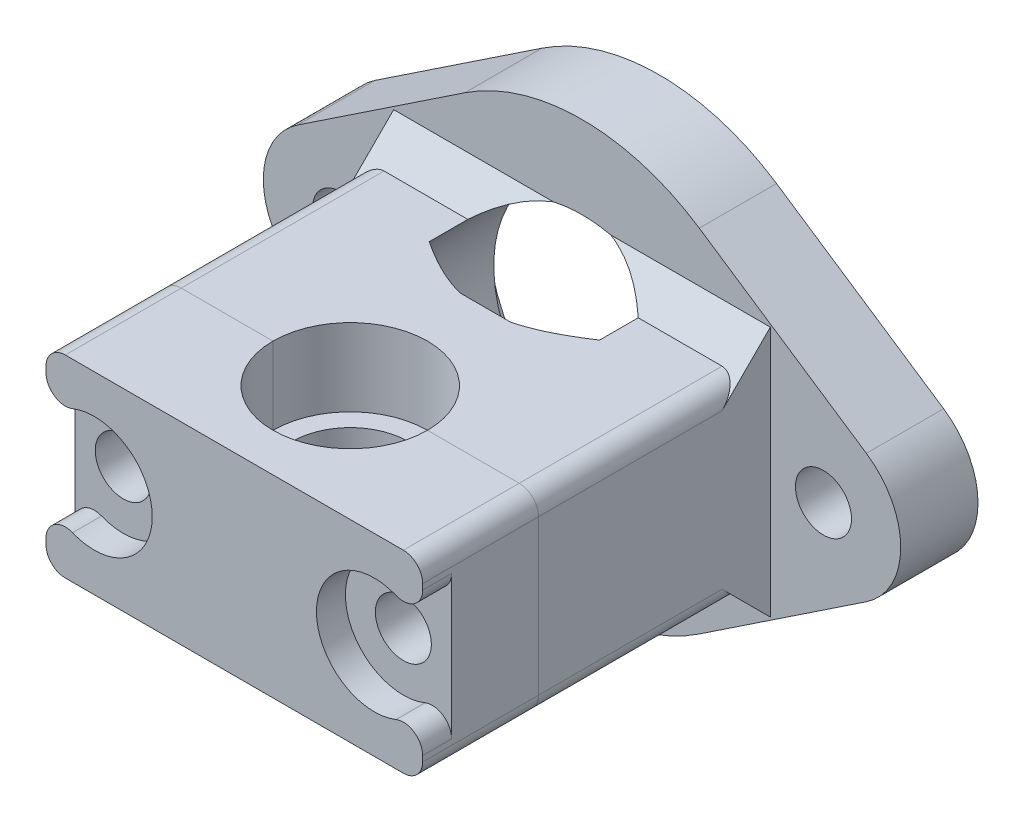
from build123d import *

# Parameters (mm, degrees)
BOSS_EXTRUDE1_DEPTH                            = 4
CUT_EXTRUDE1_DEPTH                             = 21.196012137
CUT_EXTRUDE1_DEPTH_BACK                        = 21.196012137
CUT_EXTRUDE2_DEPTH                             = 1.9
CUT_EXTRUDE2_DEPTH_BACK                        = 21.196012137
SKETCH1_6_R                                    = 8.9375
M2_5_CLEARANCE_HOLE1_D                         = 2.9
SKETCH4_W                                      = 19.5
SKETCH4_H                                      = 10
BOSS_EXTRUDE2_DEPTH                            = 12
SKETCH6_R                                      = 6.6675
CUT_EXTRUDE3_DEPTH                             = 5
SKETCH8_W                                      = 19.5
SKETCH8_H                                      = 10
BOSS_EXTRUDE3_DEPTH                            = 6
CUT_EXTRUDE4_DEPTH                             = 30.595251414
CUT_EXTRUDE4_DEPTH_BACK                        = 30.595251414
SKETCH9_R                                      = 4
BOSS_EXTRUDE4_DEPTH                            = 1
BOSS_EXTRUDE5_DEPTH                            = 1
CHAMFER2_SIZE                                  = 1.5
TAP_DRILL_FOR_M2_5X0_45_TAP1_AT_2_COUNT        = 2
TAP_DRILL_FOR_M2_5X0_45_TAP1_AT_2_PITCH        = 14.5
CBORE_FOR_M2_5_PAN_HEAD_MACHINE_SCREW1_A_COUNT = 2
CBORE_FOR_M2_5_PAN_HEAD_MACHINE_SCREW1_A_PITCH = 14.5
FILLET1_R                                      = 1
FILLET2_R                                      = 1


with BuildPart() as part:
    # Sketch1 → Boss-Extrude1 (new body)
    with BuildSketch(Plane.XY):
        with BuildLine():
            ThreePointArc((14.72, -3.327401388), (16.5, 0), (14.72, 3.327401388))
            Line((14.72, 3.327401388), (6.0703125, 9.098363172))
            ThreePointArc((6.0703125, 9.098363172), (0, 10.9375), (-6.0703125, 9.098363172))
            Line((-6.0703125, 9.098363172), (-14.72, 3.327401388))
            ThreePointArc((-14.72, 3.327401388), (-16.5, 0), (-14.72, -3.327401388))
            Line((-14.72, -3.327401388), (-6.0703125, -9.098363172))
            ThreePointArc((-6.0703125, -9.098363172), (0, -10.9375), (6.0703125, -9.098363172))
            Line((6.0703125, -9.098363172), (14.72, -3.327401388))
        make_face()
    extrude(amount=BOSS_EXTRUDE1_DEPTH)

    # Sketch1<4> → Cut-Extrude1 (cut, two sides: drawn at the far end of the back side and taken through both)
    with BuildSketch(Plane.XY.offset(-CUT_EXTRUDE1_DEPTH_BACK)):
        with BuildLine():
            ThreePointArc((-6.6675, 0), (0, -6.6675), (6.6675, 0))
            Line((6.6675, 0), (-6.6675, 0))
        make_face()
        with BuildLine():
            Line((-6.6675, 0), (6.6675, 0))
            ThreePointArc((6.6675, 0), (0, 6.6675), (-6.6675, 0))
        make_face()
    extrude(amount=CUT_EXTRUDE1_DEPTH + CUT_EXTRUDE1_DEPTH_BACK, mode=Mode.SUBTRACT)

    # Sketch1<6> → Cut-Extrude2 (cut, two sides: drawn at the far end of the back side and taken through both)
    with BuildSketch(Plane.XY.offset(-CUT_EXTRUDE2_DEPTH_BACK)):
        Circle(SKETCH1_6_R)
    extrude(amount=CUT_EXTRUDE2_DEPTH + CUT_EXTRUDE2_DEPTH_BACK, mode=Mode.SUBTRACT)

    # M2.5 Clearance Hole1 (through all)
    with Locations(Plane.XY.offset(4)):
        with Locations((-12.5, 0), (12.5, 0)):
            Hole(M2_5_CLEARANCE_HOLE1_D / 2)

    # Sketch4 → Boss-Extrude2 (add)
    with BuildSketch(Plane.XY.offset(4)):
        Rectangle(SKETCH4_W, SKETCH4_H)
    extrude(amount=BOSS_EXTRUDE2_DEPTH)

    # Sketch6 → Cut-Extrude3 (cut)
    with BuildSketch(Plane(origin=(0, 0, 4), x_dir=(-1, 0, 0), z_dir=(0, 0, -1))):
        with Locations(Location((0, 0, 0), (0, 0, 180))):
            Circle(SKETCH6_R)
    extrude(amount=-CUT_EXTRUDE3_DEPTH, mode=Mode.SUBTRACT)


with BuildPart() as body_2:
    # Sketch8 → Boss-Extrude3 (new body)
    with BuildSketch(Plane.XY.offset(16)):
        Rectangle(SKETCH8_W, SKETCH8_H)
    extrude(amount=BOSS_EXTRUDE3_DEPTH)


with BuildPart() as cut_extrude4_tool:
    # Sketch9 → Cut-Extrude4 (new, two sides: drawn at the far end of the back side and taken through both)
    with BuildSketch(Plane(origin=(0, 0, 0), x_dir=(1, 0, 0), z_dir=(0, 1, 0)).offset(-CUT_EXTRUDE4_DEPTH_BACK)):
        with Locations((0, -16)):
            Circle(SKETCH9_R)
    extrude(amount=CUT_EXTRUDE4_DEPTH + CUT_EXTRUDE4_DEPTH_BACK)


with BuildPart() as part_1:
    add(part.part)

    # Cut-Extrude4: cut by cut_extrude4_tool
    add(cut_extrude4_tool.part, mode=Mode.SUBTRACT)

    # Sketch9<3> → Boss-Extrude4 (add, symmetric)
    with BuildSketch(Plane(origin=(0, 0, 0), x_dir=(1, 0, 0), z_dir=(0, 1, 0))):
        with BuildLine():
            ThreePointArc((-3, -16), (0, -13), (3, -16))
            Line((3, -16), (4, -16))
            ThreePointArc((4, -16), (0, -12), (-4, -16))
            Line((-4, -16), (-3, -16))
        make_face()
    extrude(amount=BOSS_EXTRUDE4_DEPTH, both=True)

    # Chamfer2
    # the kernel refuses this chamfer: 1.5 mm, written as the material it adds along each edge
    with BuildSketch(Plane(origin=(9.75, -5, 4), x_dir=(0, -0.9996219169112969, -0.027495876610586497), z_dir=(-1, 0, 0))) as chamfer2_piece_1_section:
        Polygon((CHAMFER2_SIZE * 0.999621916911, CHAMFER2_SIZE * 0.0274958766106), (-CHAMFER2_SIZE * 0.0274958766106, CHAMFER2_SIZE * 0.999621916911), (0, 0), align=None)
    chamfer2_piece_1 = extrude(amount=9.196679183, mode=Mode.PRIVATE)
    chamfer2_piece_1 = chamfer2_piece_1 - Plane(origin=(0, 0, 4.474133211), x_dir=(-1, 0, 0), z_dir=(0, 0, -1)) * Cylinder(6.6675, 25, mode=Mode.PRIVATE)
    add(chamfer2_piece_1)
    with BuildSketch(Plane(origin=(0.553320817, 5, 4), x_dir=(0, 0.9996219169112969, -0.027495876610586497), z_dir=(1, 0, 0))) as chamfer2_piece_2_section:
        Polygon((CHAMFER2_SIZE * 0.999621916911, CHAMFER2_SIZE * 0.0274958766106), (-CHAMFER2_SIZE * 0.0274958766106, CHAMFER2_SIZE * 0.999621916911), (0, 0), align=None)
    chamfer2_piece_2 = extrude(amount=9.196679183, mode=Mode.PRIVATE)
    chamfer2_piece_2 = chamfer2_piece_2 - Plane(origin=(0, 0, 4.474133218), x_dir=(-1, 0, 0), z_dir=(0, 0, -1)) * Cylinder(6.6675, 25, mode=Mode.PRIVATE)
    add(chamfer2_piece_2)
    with BuildSketch(Plane(origin=(-9.75, 5, 4), x_dir=(0, 0.9996219169112969, -0.027495876610586497), z_dir=(1, 0, 0))) as chamfer2_piece_3_section:
        Polygon((CHAMFER2_SIZE * 0.999621916911, CHAMFER2_SIZE * 0.0274958766106), (-CHAMFER2_SIZE * 0.0274958766106, CHAMFER2_SIZE * 0.999621916911), (0, 0), align=None)
    chamfer2_piece_3 = extrude(amount=9.196679183, mode=Mode.PRIVATE)
    chamfer2_piece_3 = chamfer2_piece_3 - Plane(origin=(0, 0, 4.474133211), x_dir=(-1, 0, 0), z_dir=(0, 0, -1)) * Cylinder(6.6675, 25, mode=Mode.PRIVATE)
    add(chamfer2_piece_3)
    with BuildSketch(Plane(origin=(-0.553320817, -5, 4), x_dir=(0, -0.9996219169112969, -0.027495876610586497), z_dir=(-1, 0, 0))) as chamfer2_piece_4_section:
        Polygon((CHAMFER2_SIZE * 0.999621916911, CHAMFER2_SIZE * 0.0274958766106), (-CHAMFER2_SIZE * 0.0274958766106, CHAMFER2_SIZE * 0.999621916911), (0, 0), align=None)
    chamfer2_piece_4 = extrude(amount=9.196679183, mode=Mode.PRIVATE)
    chamfer2_piece_4 = chamfer2_piece_4 - Plane(origin=(0, 0, 4.474133218), x_dir=(-1, 0, 0), z_dir=(0, 0, -1)) * Cylinder(6.6675, 25, mode=Mode.PRIVATE)
    add(chamfer2_piece_4)
    with BuildSketch(Plane(origin=(0, 0, 9), x_dir=(1, 0, 0), z_dir=(0, 1, 0))) as chamfer2_piece_5_section:
        Polygon((6.6675 - CHAMFER2_SIZE, 0), (6.6675, CHAMFER2_SIZE), (6.6675, 0), align=None)
    chamfer2_piece_5 = revolve(axis=Axis((0, 0, 9), (0, 0, -1)), revolution_arc=81.734975252, mode=Mode.PRIVATE)
    chamfer2_piece_5 = split(chamfer2_piece_5, bisect_by=Plane(origin=(5.259793087, -5, 8.512416934), z_dir=(0, 1, 0)), keep=Keep.TOP, mode=Mode.PRIVATE)
    add(chamfer2_piece_5)
    with BuildSketch(Plane(origin=(0, 0, 9), x_dir=(-0.1435510514142993, -0.9896429131953854, 0), z_dir=(0.9896429131953854, -0.1435510514142993, 0))) as chamfer2_piece_6_section:
        Polygon((6.6675 - CHAMFER2_SIZE, 0), (6.6675, CHAMFER2_SIZE), (6.6675, 0), align=None)
    chamfer2_piece_6 = revolve(axis=Axis((0, 0, 9), (0, 0, -1)), revolution_arc=163.493234438, mode=Mode.PRIVATE)
    chamfer2_piece_6 = split(chamfer2_piece_6, bisect_by=Plane(origin=(-5.93475428, 5, 8.26725428), z_dir=(0, -1, 0)), keep=Keep.TOP, mode=Mode.PRIVATE)
    chamfer2_piece_6 = split(chamfer2_piece_6, bisect_by=Plane(origin=(-5.93475428, -5, 8.26725428), z_dir=(0, 1, 0)), keep=Keep.TOP, mode=Mode.PRIVATE)
    add(chamfer2_piece_6)
    with BuildSketch(Plane(origin=(0, 0, 9), x_dir=(0.14375213464834083, 0.9896137245329842, 0), z_dir=(-0.9896137245329842, 0.14375213464834083, 0))) as chamfer2_piece_7_section:
        Polygon((6.6675, CHAMFER2_SIZE), (6.6675 - CHAMFER2_SIZE, 0), (6.6675, 0), align=None)
    chamfer2_piece_7 = revolve(axis=Axis((0, 0, 9), (0, 0, -1)), revolution_arc=81.734975252, mode=Mode.PRIVATE)
    chamfer2_piece_7 = split(chamfer2_piece_7, bisect_by=Plane(origin=(5.259793397, 5, 8.512416854), z_dir=(0, -1, 0)), keep=Keep.TOP, mode=Mode.PRIVATE)
    add(chamfer2_piece_7)

    # Sketch12 → Tap Drill for M2.5x0.45 Tap1 (revolve, cut)
    with BuildSketch(Plane(origin=(-7.25, 0, 22), x_dir=(0, -1, 0), z_dir=(1, 0, 0))):
        Polygon((0, 0), (0, 13.615882135), (1.025, 13), (1.025, 0), align=None)
    tap_drill_for_m2_5x0_45_tap1 = revolve(axis=Axis((-7.25, 0, 28.35), (0, 0, -1)), mode=Mode.SUBTRACT)

    # Tap Drill for M2.5x0.45 Tap1 at 2: Tap Drill for M2.5x0.45 Tap1 ×2
    with Locations(*[(i * TAP_DRILL_FOR_M2_5X0_45_TAP1_AT_2_PITCH, 0, 0) for i in range(1, TAP_DRILL_FOR_M2_5X0_45_TAP1_AT_2_COUNT)]):
        add(tap_drill_for_m2_5x0_45_tap1, mode=Mode.SUBTRACT)

    # Fillet1
    # the kernel refuses this fillet: 1 mm, written as the material it takes off along each edge
    with BuildSketch(Plane(origin=(-9.75, 5, 3), x_dir=(1, 0, 0), z_dir=(0, 0, 1))) as fillet1_piece_1_section:
        with BuildLine():
            CenterArc((FILLET1_R, -FILLET1_R), FILLET1_R, 90, 90)
            Line((0, -FILLET1_R), (0, 0))
            Line((0, 0), (FILLET1_R, 0))
        make_face()
    fillet1_piece_1 = extrude(amount=15.5, mode=Mode.PRIVATE)
    fillet1_piece_1 = split(fillet1_piece_1, bisect_by=Plane(origin=(-9.521455398, 1.582932532, 8.917067468), z_dir=(0, 0.7071067811868302, 0.7071067811862648)), keep=Keep.TOP, mode=Mode.PRIVATE)
    add(fillet1_piece_1, mode=Mode.SUBTRACT)
    with BuildSketch(Plane(origin=(-9.75, -5, 3), x_dir=(1, 0, 0), z_dir=(0, 0, 1))) as fillet1_piece_2_section:
        with BuildLine():
            CenterArc((FILLET1_R, FILLET1_R), FILLET1_R, 180, 90)
            Line((0, FILLET1_R), (0, 0))
            Line((0, 0), (FILLET1_R, 0))
        make_face()
    fillet1_piece_2 = extrude(amount=15.5, mode=Mode.PRIVATE)
    fillet1_piece_2 = split(fillet1_piece_2, bisect_by=Plane(origin=(-9.521455398, -1.582932532, 8.917067468), z_dir=(0, -0.7071067811868302, 0.7071067811862648)), keep=Keep.TOP, mode=Mode.PRIVATE)
    add(fillet1_piece_2, mode=Mode.SUBTRACT)
    with BuildSketch(Plane(origin=(9.75, -5, 3), x_dir=(-1, 0, 0), z_dir=(0, 0, 1))) as fillet1_piece_3_section:
        with BuildLine():
            CenterArc((FILLET1_R, -FILLET1_R), FILLET1_R, 90, 90)
            Line((0, -FILLET1_R), (0, 0))
            Line((0, 0), (FILLET1_R, 0))
        make_face()
    fillet1_piece_3 = extrude(amount=15.5, mode=Mode.PRIVATE)
    fillet1_piece_3 = split(fillet1_piece_3, bisect_by=Plane(origin=(9.521455398, -1.582932532, 8.917067468), z_dir=(0, -0.7071067811868302, 0.7071067811862648)), keep=Keep.TOP, mode=Mode.PRIVATE)
    add(fillet1_piece_3, mode=Mode.SUBTRACT)
    with BuildSketch(Plane(origin=(9.75, 5, 3), x_dir=(-1, 0, 0), z_dir=(0, 0, 1))) as fillet1_piece_4_section:
        with BuildLine():
            CenterArc((FILLET1_R, FILLET1_R), FILLET1_R, 180, 90)
            Line((0, FILLET1_R), (0, 0))
            Line((0, 0), (FILLET1_R, 0))
        make_face()
    fillet1_piece_4 = extrude(amount=15.5, mode=Mode.PRIVATE)
    fillet1_piece_4 = split(fillet1_piece_4, bisect_by=Plane(origin=(9.521455398, 1.582932532, 8.917067468), z_dir=(0, 0.7071067811868302, 0.7071067811862648)), keep=Keep.TOP, mode=Mode.PRIVATE)
    add(fillet1_piece_4, mode=Mode.SUBTRACT)


with BuildPart() as body_2_1:
    add(body_2.part)

    # Cut-Extrude4: cut by cut_extrude4_tool
    add(cut_extrude4_tool.part, mode=Mode.SUBTRACT)

    # Sketch9<4> → Boss-Extrude5 (add, symmetric)
    with BuildSketch(Plane(origin=(0, 0, 0), x_dir=(1, 0, 0), z_dir=(0, 1, 0))):
        with BuildLine():
            Line((4, -16), (3, -16))
            ThreePointArc((3, -16), (0, -19), (-3, -16))
            Line((-3, -16), (-4, -16))
            ThreePointArc((-4, -16), (0, -20), (4, -16))
        make_face()
    extrude(amount=BOSS_EXTRUDE5_DEPTH, both=True)

    # Sketch14 → CBORE for M2.5 Pan Head Machine Screw1 (revolve, cut)
    with BuildSketch(Plane(origin=(7.25, 0, 22), x_dir=(0, -1, 0), z_dir=(1, 0, 0))):
        Polygon((0, 0), (0, 22), (1.45, 22), (1.45, 1.5), (3, 1.5), (3, 0), align=None)
    cbore_for_m2_5_pan_head_machine_screw1 = revolve(axis=Axis((7.25, 0, 28.35), (0, 0, -1)), mode=Mode.SUBTRACT)

    # CBORE for M2.5 Pan Head Machine Screw1 a: CBORE for M2.5 Pan Head Machine Screw1 ×2
    with Locations(*[(-i * CBORE_FOR_M2_5_PAN_HEAD_MACHINE_SCREW1_A_PITCH, 0, 0) for i in range(1, CBORE_FOR_M2_5_PAN_HEAD_MACHINE_SCREW1_A_COUNT)]):
        add(cbore_for_m2_5_pan_head_machine_screw1, mode=Mode.SUBTRACT)

    # Fillet2
    fillet2_edges = [body_2_1.edges().sort_by_distance(p)[0] for p in [
        (-9.75, 1.658312395, 21.25),
        (-9.75, -1.658312395, 21.25),
        (9.75, -1.658312395, 21.25),
        (9.75, 1.658312395, 21.25),
        (9.75, 5, 19),
        (9.75, -5, 19),
        (-9.75, -5, 19),
        (-9.75, 5, 19),
    ]]
    fillet(fillet2_edges, radius=FILLET2_R)


solid = Compound([part_1.part, body_2_1.part])
